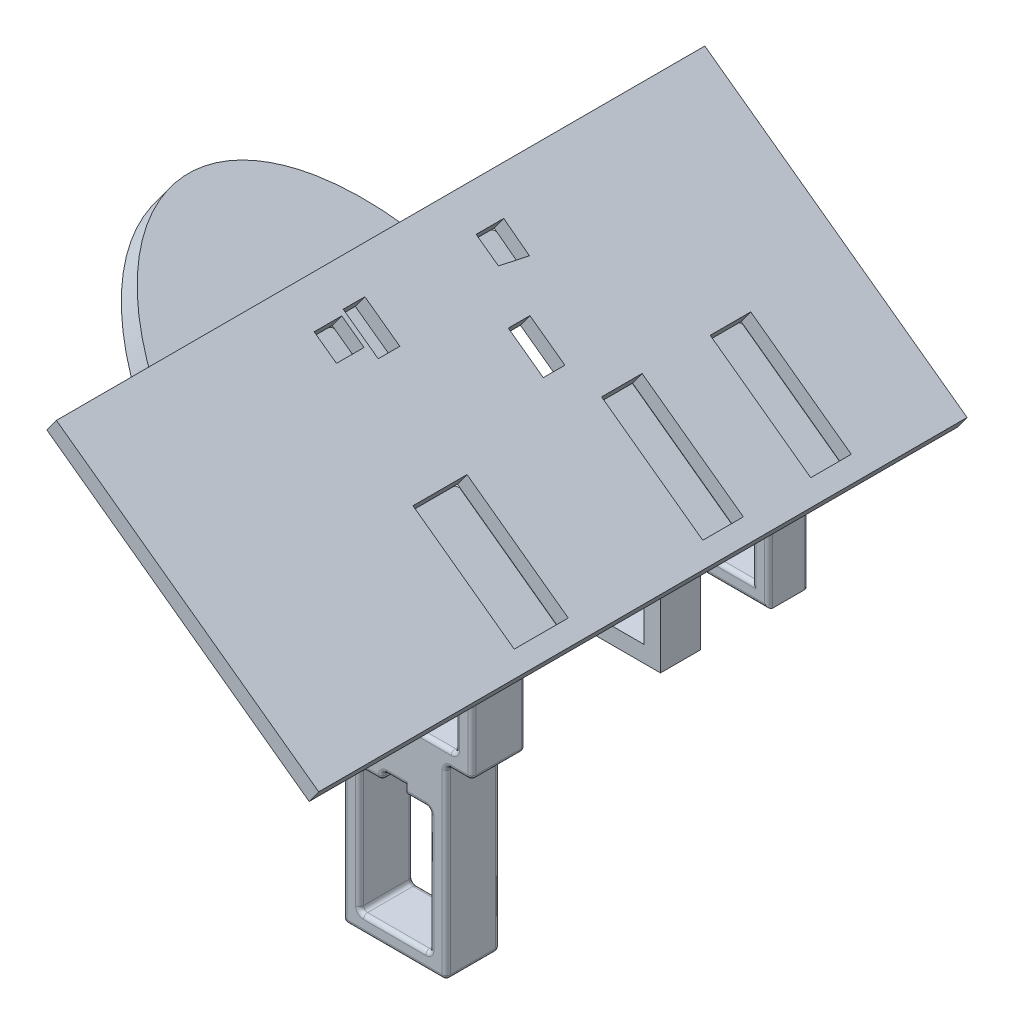
from build123d import *

# Parameters (mm, degrees)
SKETCH3_W                = 22.5
SKETCH3_H                = 8.3
BOSS_EXTRUDE1_DEPTH      = 9.9
SKETCH4_W                = 60
SKETCH4_H                = 120
BOSS_EXTRUDE2_DEPTH      = 3
BOSS_EXTRUDE3_DEPTH      = 24.5
BOSS_EXTRUDE3_DEPTH_BACK = 3
SKETCH7_W                = 5.1
SKETCH7_H                = 5.1
BOSS_EXTRUDE4_DEPTH      = 5
SKETCH9_W                = 22.5
SKETCH9_H                = 8.3
BOSS_EXTRUDE5_DEPTH      = 7.4
SKETCH10_W               = 22.5
SKETCH10_H               = 8.3
BOSS_EXTRUDE6_DEPTH      = 7.4
SKETCH7_2_W              = 5.1
SKETCH7_2_H              = 5.1
CUT_EXTRUDE4_DEPTH       = 10
SKETCH6_W                = 8
SKETCH6_H                = 4
CUT_EXTRUDE1_DEPTH       = 3
FILLET1_R                = 0.75
FILLET4_R                = 0.75
CHAMFER1_SIZE            = 2
FILLET6_R                = 0.75
SKETCH11_W               = 23.16
SKETCH11_H               = 10
SKETCH11_W_2             = 23.156984
SKETCH11_H_2             = 7.5
SKETCH11_W_3             = 23
CUT_EXTRUDE5_DEPTH       = 10


with BuildPart() as part:
    # Sketch3 → Boss-Extrude1 (new body)
    with BuildSketch(Plane.XY):
        Polygon((14.3013065, -7.2013065), (14.3013065, 7.2013065), (20.408395271, 15.606993071), (1.687742021, 29.208343809), (-14.3013065, 7.2013065), (-14.3013065, -7.2013065), (-9.5513065, -7.2013065), (-9.5513065, -12.3986935), (-9.5513065, -41.6013065), (9.5513065, -41.6013065), (9.5513065, -12.3986935), (9.5513065, -7.2013065), align=None)
        Rectangle(SKETCH3_W, SKETCH3_H, mode=Mode.SUBTRACT)
        Polygon((-6.5, -15.45), (-6.5, -38.55), (6.5, -38.55), (6.5, -15.45), (2.25, -15.45), (2.25, -13.95), (-2.25, -13.95), (-2.25, -15.45), align=None, mode=Mode.SUBTRACT)
    extrude(amount=BOSS_EXTRUDE1_DEPTH)

    # Sketch4 → Boss-Extrude2 (add)
    with BuildSketch(Plane(origin=(14.472493382, 19.919678235, 0), x_dir=(0.8090169943749486, -0.5877852522924718, 0), z_dir=(0.5877852522924718, 0.8090169943749486, 0))):
        with Locations((-19.232821758, 11.1)):
            Rectangle(SKETCH4_W, SKETCH4_H)
    extrude(amount=BOSS_EXTRUDE2_DEPTH)

    # Sketch7 → Boss-Extrude3 (add, two sides: drawn at the far end of the back side and taken through both)
    with BuildSketch(Plane(origin=(14.472493382, 19.919678235, 0), x_dir=(0.8090169943749486, -0.5877852522924717, 0), z_dir=(-0.5877852522924717, -0.8090169943749486, 0)).offset(-BOSS_EXTRUDE3_DEPTH_BACK)):
        with Locations((-39.769933784, 4.239805204)):
            Rectangle(SKETCH7_W, SKETCH7_H)
        Polygon((-37.668734758, -23.55), (-36.771133315, -28.570389592), (-42.768734758, -28.65), (-42.768734758, -23.55), align=None)
    extrude(amount=BOSS_EXTRUDE3_DEPTH + BOSS_EXTRUDE3_DEPTH_BACK)

    # Sketch8 → Boss-Extrude4 (add)
    with BuildSketch(Plane(origin=(0.071754701, 0.098761873, 0), x_dir=(0.8090169943749483, -0.587785252292472, 0), z_dir=(-0.587785252292472, -0.8090169943749483, 0))):
        with BuildLine():
            Line((-24.218734505, 5.850397894), (-24.218734505, -28.050397894))
            Line((-24.218734505, -28.050397894), (-35.532443004, -39.364106393))
            add(Edge.make_bspline(
                [(-35.532443004, 17.164106393), (-73.189679073, 11.859740449), (-73.189679073, -11.1), (-73.189679073, -34.059740449), (-35.532443004, -39.364106393)],
                knots=[4.945524145, 4.945524145, 4.945524145, 6.283185307, 6.283185307, 7.620846469, 7.620846469, 7.620846469], degree=2, weights=[1, 0.784547323, 1, 0.784547323, 1]))
            Line((-35.532443004, 17.164106393), (-24.218734505, 5.850397894))
        make_face()
    extrude(amount=BOSS_EXTRUDE4_DEPTH)

    # Sketch9 → Boss-Extrude5 (add)
    with BuildSketch(Plane(origin=(0, 0, -25), x_dir=(-1, 0, 0), z_dir=(0, 0, -1))):
        Polygon((-22.171751028, 18.034044054), (-14.3013065, 7.2013065), (-14.3013065, -7.2013065), (9.5513065, -7.2013065), (14.3013065, -7.2013065), (14.3013065, 7.2013065), (-3.451097778, 31.635394792), align=None)
        Rectangle(SKETCH9_W, SKETCH9_H, mode=Mode.SUBTRACT)
    extrude(amount=BOSS_EXTRUDE5_DEPTH)

    # Sketch10 → Boss-Extrude6 (add)
    with BuildSketch(Plane(origin=(0, 0, -45), x_dir=(-1, 0, 0), z_dir=(0, 0, -1))):
        Polygon((-22.171751028, 18.034044054), (-14.3013065, 7.2013065), (-14.3013065, -7.2013065), (14.3013065, -7.2013065), (14.3013065, 7.2013065), (-3.451097778, 31.635394792), align=None)
        Rectangle(SKETCH10_W, SKETCH10_H, mode=Mode.SUBTRACT)
    extrude(amount=BOSS_EXTRUDE6_DEPTH)

    # Sketch7<2> → Cut-Extrude4 (cut)
    with BuildSketch(Plane(origin=(14.472493382, 19.919678235, 0), x_dir=(0.8090169943749486, -0.5877852522924717, 0), z_dir=(-0.5877852522924717, -0.8090169943749486, 0))):
        with Locations((-39.769933784, 4.239805204)):
            Rectangle(SKETCH7_2_W, SKETCH7_2_H)
        Polygon((-37.668734758, -23.55), (-36.771133315, -28.570389592), (-42.768734758, -28.65), (-42.768734758, -23.55), align=None)
    extrude(amount=-CUT_EXTRUDE4_DEPTH, mode=Mode.SUBTRACT)


with BuildPart() as cut_extrude4_piece_1:
    # of the separate pieces the step leaves, piece 1, a body of its own (cut_extrude4_pieces)
    add(part.part.solids().sort_by_distance((-25.357696101, 48.858004793, -71.1))[0])

    # Sketch6 → Cut-Extrude1 (cut)
    with BuildSketch(Plane(origin=(14.472493382, 19.919678235, 0), x_dir=(0.8090169943749486, -0.5877852522924717, 0), z_dir=(-0.5877852522924717, -0.8090169943749486, 0))):
        with Locations((-25.882821758, -21.075)):
            Rectangle(SKETCH6_W, SKETCH6_H)
        with Locations((-38.982821758, -1.125)):
            Rectangle(SKETCH6_W, SKETCH6_H)
    extrude(amount=-CUT_EXTRUDE1_DEPTH, mode=Mode.SUBTRACT)

    # Fillet1
    fillet1_edges = [cut_extrude4_piece_1.edges().sort_by_distance(p)[0] for p in [
        (9.5513065, -24.4013065, 0),
        (0, -41.6013065, 0),
        (14.3013065, 0, 9.9),
        (-9.5513065, -24.4013065, 0),
        (-11.9263065, -7.2013065, 0),
        (-14.3013065, 0, 0),
        (-6.306782239, 18.204825154, 0),
        (17.354850885, 11.404149785, 0),
        (14.3013065, 0, 0),
        (11.9263065, -7.2013065, 0),
        (17.354850885, 11.404149785, 9.9),
        (9.5513065, -41.6013065, 4.95),
        (-9.5513065, -41.6013065, 4.95),
        (-9.5513065, -7.2013065, 4.95),
        (-14.3013065, -7.2013065, 4.95),
        (-14.3013065, 7.2013065, 4.95),
        (14.3013065, 7.2013065, 4.95),
        (14.3013065, -7.2013065, 4.95),
        (9.5513065, -7.2013065, 4.95),
        (-6.306782239, 18.204825154, 9.9),
        (-14.3013065, 0, 9.9),
        (-11.9263065, -7.2013065, 9.9),
        (11.25, 0, 0),
        (11.25, -4.15, 4.95),
        (0, 4.15, 0),
        (11.25, 4.15, 4.95),
        (-11.25, 0, 0),
        (-11.25, 4.15, 4.95),
        (0, -4.15, 0),
        (-11.25, -4.15, 4.95),
        (11.25, 0, 9.9),
        (0, 4.15, 9.9),
        (-11.25, 0, 9.9),
        (-9.5513065, -24.4013065, 9.9),
        (0, -4.15, 9.9),
        (0, -41.6013065, 9.9),
        (9.5513065, -24.4013065, 9.9),
        (6.5, -27, 0),
        (6.5, -38.55, 4.95),
        (4.375, -15.45, 0),
        (6.5, -15.45, 4.95),
        (0, -13.95, 0),
        (-2.25, -14.7, 0),
        (-2.25, -13.95, 4.95),
        (-4.375, -15.45, 0),
        (-2.25, -15.45, 4.95),
        (-6.5, -27, 0),
        (-6.5, -15.45, 4.95),
        (0, -38.55, 0),
        (-6.5, -38.55, 4.95),
        (6.5, -27, 9.9),
        (4.375, -15.45, 9.9),
        (0, -13.95, 9.9),
        (-2.25, -14.7, 9.9),
        (-4.375, -15.45, 9.9),
        (-6.5, -27, 9.9),
        (0, -38.55, 9.9),
        (11.9263065, -7.2013065, 9.9),
    ]]
    fillet(fillet1_edges, radius=FILLET1_R - 0.0001)  # a hair under: the kernel refuses the full size

    # Fillet4
    fillet4_edges = [cut_extrude4_piece_1.edges().sort_by_distance(p)[0] for p in [
        (-6.306782239, 18.204825154, -52.4),
        (17.354850885, 11.404149785, -52.4),
        (14.3013065, 0, -52.4),
        (0, -7.2013065, -52.4),
        (-14.3013065, 0, -52.4),
        (0, 4.15, -45),
        (11.25, 0, -45),
        (0, -4.15, -45),
        (-11.25, 0, -45),
        (17.354850885, 11.404149785, -45),
        (-6.306782239, 18.204825154, -45),
        (-14.3013065, 7.2013065, -48.7),
        (14.3013065, 0, -45),
        (14.3013065, 7.2013065, -48.7),
        (0, -7.2013065, -45),
        (-14.3013065, 0, -45),
        (-14.3013065, -7.2013065, -48.7),
        (11.25, 0, -52.4),
        (0, -4.15, -52.4),
        (-11.25, -4.15, -48.7),
        (-11.25, 0, -52.4),
        (-11.25, 4.15, -48.7),
        (0, 4.15, -52.4),
        (11.25, 4.15, -48.7),
    ]]
    fillet(fillet4_edges, radius=FILLET4_R)

    # Sketch11 → Cut-Extrude5 (cut)
    with BuildSketch(Plane(origin=(14.472493382, 19.919678235, 0), x_dir=(0.8090169943749483, -0.5877852522924719, 0), z_dir=(-0.5877852522924719, -0.8090169943749485, 0))):
        with Locations((-4.232821758, 4.95)):
            Rectangle(SKETCH11_W, SKETCH11_H)
        with Locations((-4.232821758, -28.7)):
            Rectangle(SKETCH11_W_2, SKETCH11_H_2)
        with Locations((-4.182821758, -48.7)):
            Rectangle(SKETCH11_W_3, SKETCH11_H_2)
    extrude(amount=-CUT_EXTRUDE5_DEPTH, mode=Mode.SUBTRACT)


with BuildPart() as cut_extrude4_piece_2:
    # of the separate pieces the step leaves, piece 2, a body of its own (cut_extrude4_pieces)
    add(part.part.solids().sort_by_distance((-19.521613096, 14.334176845, 5.850397894))[0])

    # Chamfer1
    chamfer1_edges = [cut_extrude4_piece_2.edges().sort_by_distance(p)[0] for p in [
        (-34.165790931, 24.973794829, 4.239805204),
        (-32.102797595, 23.474942436, 1.689805204),
        (-30.03980426, 21.976090043, 4.239805204),
        (-32.102797595, 23.474942436, 6.789805204),
        (-32.46588521, 23.73874103, -23.55),
        (-34.528878546, 25.237593423, -26.1),
        (-32.1027978, 23.474942585, -28.610194796),
        (-30.039804464, 21.976090191, -26.060194796),
    ]]
    chamfer(chamfer1_edges, length=CHAMFER1_SIZE)

    # Fillet6
    fillet6_edges = [cut_extrude4_piece_2.edges().sort_by_distance(p)[0] for p in [
        (-26.377636338, 35.693270005, 6.789805204),
        (-22.251649667, 32.695565218, 6.789805204),
        (-22.251649667, 32.695565218, 1.689805204),
        (-26.740723953, 35.957068599, -23.55),
        (-22.614737282, 32.959363812, -23.55),
        (-21.888562461, 32.431766922, -28.570389592),
        (-26.740723953, 35.957068599, -28.65),
        (-26.377636338, 35.693270005, 1.689805204),
    ]]
    fillet(fillet6_edges, radius=FILLET6_R)


with BuildPart() as cut_extrude5_piece_1:
    # of the separate pieces the step leaves, piece 1, a body of its own (cut_extrude5_pieces)
    add(cut_extrude4_piece_1.part.solids().sort_by_distance((-25.357696101, 48.858004793, -71.1))[0])


with BuildPart() as cut_extrude5_piece_2:
    # of the separate pieces the step leaves, piece 2, a body of its own (cut_extrude5_pieces)
    add(cut_extrude4_piece_1.part.solids().sort_by_distance((19.801713427, 16.047773232, 9.9))[0])


with BuildPart() as cut_extrude5_piece_3:
    # of the separate pieces the step leaves, piece 3, a body of its own (cut_extrude5_pieces)
    add(cut_extrude4_piece_1.part.solids().sort_by_distance((1.687742021, 29.208343809, -25))[0])


solid = Compound([cut_extrude4_piece_2.part, cut_extrude5_piece_1.part, cut_extrude5_piece_2.part, cut_extrude5_piece_3.part])
